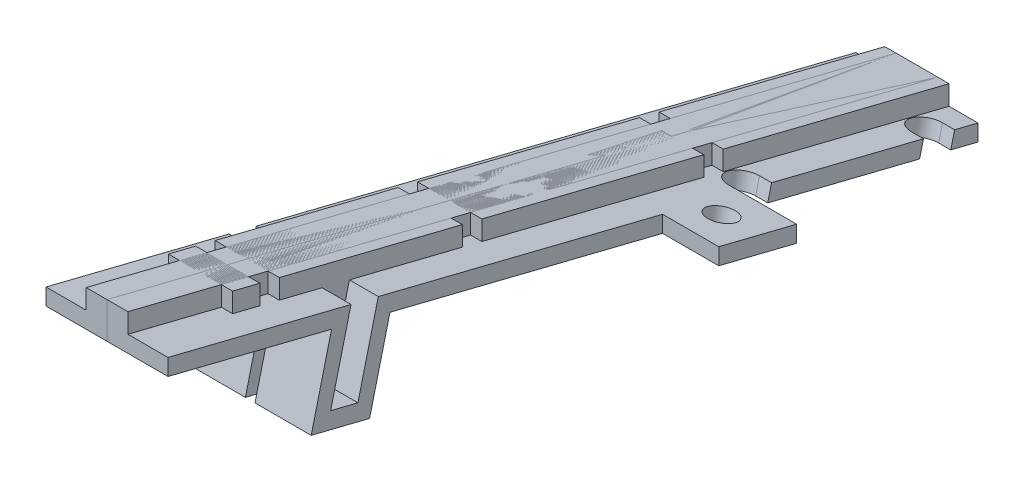
from build123d import *

# Parameters (mm, degrees)
LEFT_START                   = -2.6
LEFT_SIDE_FOR_MIRROR_DEPTH   = 6.6
LEFT_START_2                 = -7.6
LEFT_SIDE_FOR_MIRROR_2_DEPTH = 7
LEFT_SIDE_FOR_MIRROR_3_DEPTH = 2
LEFT_START_3                 = -0.6
LEFT_SIDE_FOR_MIRROR_4_DEPTH = 0.6
BOSS_EXTRUDE1_DEPTH          = 7
SKETCH3_R                    = 1.75
CUT_EXTRUDE1_DEPTH           = 7
CUT_EXTRUDE2_DEPTH           = 7


# Read off the part's stored shape, not the designer's step: Left side (for mirror)
with BuildPart() as part:
    # Left side (for mirror) outline → Left side (for mirror) (new body)
    with BuildSketch(Plane.YZ.offset(LEFT_START)):
        Polygon((-19.741079423, -61.128630755), (-26.756814395, -89.267206817), (-22.256814395, -89.267206817), (-15.241079423, -61.128630755), align=None)
        Polygon((-12.241500659, -31.049463241), (-19.136274684, -58.70289144), (-14.636274684, -58.70289144), (-7.741500659, -31.049463241), align=None)
        Polygon((-11.63669592, -28.623723925), (-7.13669592, -28.623723925), (-1.451531374, -5.821774358), (-5.951531374, -5.821774358), align=None)
        Polygon((-0.846726635, -3.396035042), (0, 0), (-4.5, 0), (-5.346726635, -3.396035042), align=None)
    extrude(amount=LEFT_SIDE_FOR_MIRROR_DEPTH)

    # Left side _for mirror 2 outline → Left side _for mirror 2 (add)
    with BuildSketch(Plane.YZ.offset(LEFT_START_2)):
        Polygon((-26.756814395, -89.267206817), (-24.695587136, -89.267206817), (-6.067601175, -14.554435894), (-16.255706301, -12.01425599), (-15.408979667, -8.618220948), (-5.220874541, -11.158400852), (0.464290006, 11.643548715), (-1.596937253, 11.643548715), (-6.677622202, -8.733965608), (-16.865727328, -6.193785705), (-18.680141545, -13.471003652), (-8.492036419, -16.011183555), align=None)
    extrude(amount=LEFT_SIDE_FOR_MIRROR_2_DEPTH)



with BuildPart() as body_2:
    # Left side _for mirror 3 outline → Left side _for mirror 3 (new body)
    with BuildSketch(Plane.YZ.offset(LEFT_START)):
        Polygon((-17.075047425, -58.70289144), (-17.679852164, -61.128630755), (-15.241079423, -61.128630755), (-14.636274684, -58.70289144), align=None)
        Polygon((-9.575468661, -28.623723925), (-10.1802734, -31.049463241), (-7.741500659, -31.049463241), (-7.13669592, -28.623723925), align=None)
        Polygon((-16.255706301, -12.01425599), (-8.008192628, -14.070592103), (-7.161465993, -10.674557061), (-15.408979667, -8.618220948), align=None)
        Polygon((-3.890304115, -5.821774358), (-1.451531374, -5.821774358), (-0.846726635, -3.396035042), (-3.285499376, -3.396035042), align=None)
        Polygon((-2.438772741, 0), (0, 0), (2.903062747, 11.643548715), (0.464290006, 11.643548715), align=None)
    extrude(amount=LEFT_SIDE_FOR_MIRROR_3_DEPTH)


with BuildPart() as part_1:
    add(part.part)

    add(body_2.part)  # Left side _for mirror 4 merges body 2
    # Left side _for mirror 4 outline → Left side _for mirror 4 (add)
    with BuildSketch(Plane.YZ.offset(LEFT_START_3)):
        Polygon((-19.136274684, -58.70289144), (-19.741079423, -61.128630755), (-15.241079423, -61.128630755), (-14.636274684, -58.70289144), align=None)
        Polygon((-11.63669592, -28.623723925), (-12.241500659, -31.049463241), (-7.741500659, -31.049463241), (-7.13669592, -28.623723925), align=None)
        Polygon((-1.451531374, -5.821774358), (-0.846726635, -3.396035042), (-5.346726635, -3.396035042), (-5.951531374, -5.821774358), align=None)
        Polygon((0, 0), (2.903062747, 11.643548715), (-1.596937253, 11.643548715), (-4.5, 0), align=None)
    extrude(amount=LEFT_SIDE_FOR_MIRROR_4_DEPTH)


with BuildPart() as body_2_2:
    # Mirror4: mirrored copy
    add(part_1.part.mirror(Plane(origin=(0, 0, 0), x_dir=(0, 0, 1), z_dir=(1, 0, 0))))

    # Sketch2 → Boss-Extrude1 (add)
    with BuildSketch(Plane(origin=(7.6, 0, 0), x_dir=(0, 0, -1), z_dir=(1, 0, 0))):
        Polygon((49.970229903, -14.897750365), (49.970229903, -16.958977623), (59.673187166, -19.378196579), (59.673187166, -17.316969321), align=None)
    extrude(amount=BOSS_EXTRUDE1_DEPTH)

    # Sketch3 → Cut-Extrude1 (cut)
    with BuildSketch(Plane(origin=(0, -2.296040631, 0.572467225), x_dir=(1, 0, 0), z_dir=(0, 0.9702957262759965, -0.24192189559966834))):
        with Locations(Location((10.1, 57.089992525, 0), (0, 0, 270))):
            Circle(SKETCH3_R)
    extrude(amount=-CUT_EXTRUDE1_DEPTH, mode=Mode.SUBTRACT)

    # Sketch5 → Cut-Extrude2 (cut)
    with BuildSketch(Plane(origin=(0, -2.296040631, 0.572467225), x_dir=(1, 0, 0), z_dir=(0, 0.9702957262759965, -0.24192189559966834))):
        with BuildLine():
            Line((6.1, 62.089992525), (7.6, 62.089992525))
            Line((7.6, 62.089992525), (7.6, 66.089992525))
            Line((7.6, 66.089992525), (6.1, 66.089992525))
            ThreePointArc((6.1, 66.089992525), (4.1, 64.089992525), (6.1, 62.089992525))
        make_face()
        with BuildLine():
            Line((6.1, 85.589992525), (7.6, 85.589992525))
            Line((7.6, 85.589992525), (7.6, 89.589992525))
            Line((7.6, 89.589992525), (6.1, 89.589992525))
            ThreePointArc((6.1, 89.589992525), (4.1, 87.589992525), (6.1, 85.589992525))
        make_face()
    extrude(amount=-CUT_EXTRUDE2_DEPTH, mode=Mode.SUBTRACT)


solid = Compound([part_1.part, body_2_2.part])
